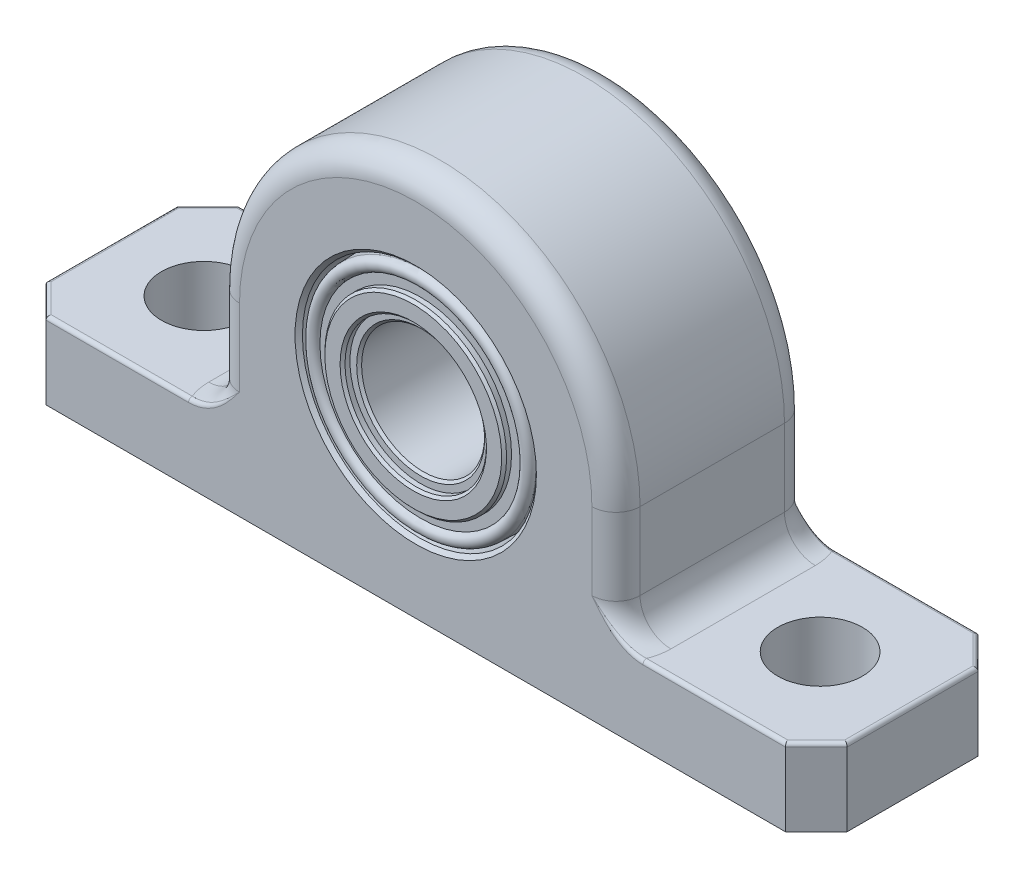
from build123d import *

# Parameters (mm, degrees)
BOSS_EXTRUDE1_DEPTH      = 9.921875
BOSS_EXTRUDE1_DEPTH_BACK = 9.921875
SKETCH3_R                = 12.05738
SKETCH4_R                = 4.365625
CUT_EXTRUDE1_DEPTH       = 59.113396775
CHAMFER1_SIZE            = 3.175
FILLET1_R                = 2.48046875
FILLET2_R                = 3.175
CHAMFER2_SIZE            = 0.381
FILLET3_R                = 0.381
CHAMFER3_SIZE            = 0.254


with BuildPart() as part:
    # Sketch3 → Boss-Extrude1 (new, two sides: drawn at the far end of the back side and taken through both)
    with BuildSketch(Plane.XY.offset(-BOSS_EXTRUDE1_DEPTH_BACK)):
        with BuildLine():
            Line((-41.275, 0), (-41.275, 7.9375))
            Line((-41.275, 7.9375), (-20.6375, 7.9375))
            Line((-20.6375, 7.9375), (-20.6375, 19.05))
            ThreePointArc((-20.6375, 19.05), (0, 39.6875), (20.6375, 19.05))
            Line((20.6375, 19.05), (20.6375, 7.9375))
            Line((20.6375, 7.9375), (41.275, 7.9375))
            Line((41.275, 7.9375), (41.275, 0))
            Line((41.275, 0), (-41.275, 0))
        make_face()
        with Locations((0, 19.05)):
            Circle(SKETCH3_R, mode=Mode.SUBTRACT)
    extrude(amount=BOSS_EXTRUDE1_DEPTH + BOSS_EXTRUDE1_DEPTH_BACK)

    # Sketch4 → Cut-Extrude1 (cut, through all)
    with BuildSketch(Plane(origin=(0, 0, 0), x_dir=(1, 0, 0), z_dir=(0, 1, 0))):
        with Locations(Location((-31.75, 0, 0), (0, 0, 90))):
            Circle(SKETCH4_R)
        with Locations(Location((31.75, 0, 0), (0, 0, 90))):
            Circle(SKETCH4_R)
    extrude(amount=CUT_EXTRUDE1_DEPTH, mode=Mode.SUBTRACT)

    # Chamfer1
    chamfer1_edges = [part.edges().sort_by_distance(p)[0] for p in [
        (41.275, 3.96875, 9.921875),
        (-41.275, 3.96875, -9.921875),
        (-41.275, 3.96875, 9.921875),
        (41.275, 3.96875, -9.921875),
    ]]
    chamfer(chamfer1_edges, length=CHAMFER1_SIZE)

    # Fillet1
    fillet1_edges = [part.edges().sort_by_distance(p)[0] for p in [
        (20.6375, 13.49375, -9.921875),
        (0, 39.6875, -9.921875),
        (-20.6375, 13.49375, -9.921875),
        (20.6375, 13.49375, 9.921875),
        (0, 39.6875, 9.921875),
        (-20.6375, 13.49375, 9.921875),
    ]]
    fillet(fillet1_edges, radius=FILLET1_R)

    # Fillet2
    # the kernel refuses this fillet: 3.175 mm, written as the material it adds along each edge
    with BuildSketch(Plane(origin=(-20.6375, 7.9375, 7.44140625), x_dir=(-1, 0, 0), z_dir=(0, 0, -1))) as fillet2_piece_1:
        with BuildLine():
            CenterArc((FILLET2_R, FILLET2_R), FILLET2_R, 180, 90)
            Line((0, FILLET2_R), (0, 0))
            Line((0, 0), (FILLET2_R, 0))
        make_face()
    extrude(amount=14.8828125)
    with BuildSketch(Plane(origin=(20.6375, 7.9375, 7.44140625), x_dir=(1, 0, 0), z_dir=(0, 0, -1))) as fillet2_piece_2:
        with BuildLine():
            CenterArc((FILLET2_R, -FILLET2_R), FILLET2_R, 90, 90)
            Line((0, -FILLET2_R), (0, 0))
            Line((0, 0), (FILLET2_R, 0))
        make_face()
    extrude(amount=14.8828125)
    with BuildSketch(Plane(origin=(-18.15703125, 7.9375, -7.44140625), x_dir=(-0.059657368932763404, 0, 0.9982189130306137), z_dir=(-0.9982189130306137, 0, -0.059657368932763404))) as fillet2_piece_3_section:
        with BuildLine():
            CenterArc((-2.48046875 - FILLET2_R, FILLET2_R), FILLET2_R, 270, 90)
            Line((-2.48046875, FILLET2_R), (-2.48046875, 0))
            Line((-2.48046875, 0), (-2.48046875 - FILLET2_R, 0))
        make_face()
    fillet2_piece_3 = revolve(axis=Axis((-18.15703125, 7.9375, -7.44140625), (0, 1, 0)), revolution_arc=273.420146224, mode=Mode.PRIVATE)
    fillet2_piece_3 = split(fillet2_piece_3, bisect_by=Plane(origin=(-20.028102213, 8.977488028, -9.921875), z_dir=(0, 0, 1)), keep=Keep.TOP, mode=Mode.PRIVATE)
    add(fillet2_piece_3)
    with BuildSketch(Plane(origin=(-18.15703125, 7.9375, 7.44140625), x_dir=(-0.059657368932763404, 0, -0.9982189130306137), z_dir=(-0.9982189130306137, 0, 0.059657368932763404))) as fillet2_piece_4_section:
        with BuildLine():
            CenterArc((-2.48046875 - FILLET2_R, -FILLET2_R), FILLET2_R, 0, 90)
            Line((-2.48046875, -FILLET2_R), (-2.48046875, 0))
            Line((-2.48046875, 0), (-2.48046875 - FILLET2_R, 0))
        make_face()
    fillet2_piece_4 = revolve(axis=Axis((-18.15703125, 7.9375, 7.44140625), (0, -1, 0)), revolution_arc=273.420146224, mode=Mode.PRIVATE)
    fillet2_piece_4 = split(fillet2_piece_4, bisect_by=Plane(origin=(-20.028102213, 8.977488028, 9.921875), z_dir=(0, 0, -1)), keep=Keep.TOP, mode=Mode.PRIVATE)
    add(fillet2_piece_4)
    with BuildSketch(Plane(origin=(18.15703125, 7.9375, -7.44140625), x_dir=(0.05965736893276484, 0, 0.9982189130306137), z_dir=(0.9982189130306137, 0, -0.05965736893276484))) as fillet2_piece_5_section:
        with BuildLine():
            CenterArc((-2.48046875 - FILLET2_R, -FILLET2_R), FILLET2_R, 0, 90)
            Line((-2.48046875, -FILLET2_R), (-2.48046875, 0))
            Line((-2.48046875, 0), (-2.48046875 - FILLET2_R, 0))
        make_face()
    fillet2_piece_5 = revolve(axis=Axis((18.15703125, 7.9375, -7.44140625), (0, -1, 0)), revolution_arc=273.420146224, mode=Mode.PRIVATE)
    fillet2_piece_5 = split(fillet2_piece_5, bisect_by=Plane(origin=(20.028102127, 8.977488302, -9.921875), z_dir=(0, 0, 1)), keep=Keep.TOP, mode=Mode.PRIVATE)
    add(fillet2_piece_5)
    with BuildSketch(Plane(origin=(18.15703125, 7.9375, 7.44140625), x_dir=(0.05965736893276484, 0, -0.9982189130306137), z_dir=(0.9982189130306137, 0, 0.05965736893276484))) as fillet2_piece_6_section:
        with BuildLine():
            CenterArc((-2.48046875 - FILLET2_R, FILLET2_R), FILLET2_R, 270, 90)
            Line((-2.48046875, FILLET2_R), (-2.48046875, 0))
            Line((-2.48046875, 0), (-2.48046875 - FILLET2_R, 0))
        make_face()
    fillet2_piece_6 = revolve(axis=Axis((18.15703125, 7.9375, 7.44140625), (0, 1, 0)), revolution_arc=273.420146224, mode=Mode.PRIVATE)
    fillet2_piece_6 = split(fillet2_piece_6, bisect_by=Plane(origin=(20.028102127, 8.977488302, 9.921875), z_dir=(0, 0, -1)), keep=Keep.TOP, mode=Mode.PRIVATE)
    add(fillet2_piece_6)

    # Chamfer2
    chamfer2_edges = [part.edges().sort_by_distance(p)[0] for p in [
        (-12.05738, 19.05, -9.921875),
        (-12.05738, 19.05, 9.921875),
    ]]
    chamfer(chamfer2_edges, length=CHAMFER2_SIZE)

    # Fillet3
    fillet3_edges = [part.edges().sort_by_distance(p)[0] for p in [
        (-30.669755557, 7.9375, -9.921875),
        (-30.669755557, 7.9375, 9.921875),
        (-20.369956081, 8.957174187, -9.921875),
        (-20.369956063, 8.957174199, 9.921875),
        (20.369956063, 8.957174199, -9.921875),
        (20.369956084, 8.957174184, 9.921875),
        (-41.275, 7.9375, 0),
        (30.669755557, 7.9375, -9.921875),
        (-39.6875, 7.9375, 8.334375),
        (-39.6875, 7.9375, -8.334375),
        (30.669755557, 7.9375, 9.921875),
        (41.275, 7.9375, 0),
        (39.6875, 7.9375, -8.334375),
        (39.6875, 7.9375, 8.334375),
    ]]
    fillet(fillet3_edges, radius=FILLET3_R)


with BuildPart() as body_2:
    # Sketch6 → Revolve1 (revolve)
    with BuildSketch(Plane(origin=(0, 0, 0), x_dir=(0, 0, -1), z_dir=(1, 0, 0)), mode=Mode.PRIVATE) as revolve1_sk:
        with BuildLine():
            Line((0, 31.10738), (9.921875, 31.10738))
            Line((9.921875, 31.10738), (9.921875, 29.43207627))
            Line((9.921875, 29.43207627), (6.111875, 29.43207627))
            Line((6.111875, 29.43207627), (6.111875, 28.417924091))
            Line((6.111875, 28.417924091), (8.651875, 28.417924091))
            Line((8.651875, 28.417924091), (8.651875, 26.337895))
            Line((8.651875, 26.337895), (7.889875, 26.337895))
            Line((7.889875, 26.337895), (7.889875, 25.3873))
            Line((7.889875, 25.3873), (-9.413875, 25.3873))
            Line((-9.413875, 25.3873), (-9.413875, 26.337895))
            Line((-9.413875, 26.337895), (-10.175875, 26.337895))
            Line((-10.175875, 26.337895), (-10.175875, 28.417924091))
            Line((-10.175875, 28.417924091), (-9.413875, 28.417924091))
            Line((-9.413875, 28.417924091), (-9.413875, 29.43207627))
            ThreePointArc((-9.413875, 29.43207627), (-9.917326931, 30.175277339), (-9.257666022, 30.784095179))
            Line((-9.257666022, 30.784095179), (0, 31.10738))
        make_face()
    revolve(revolve1_sk.sketch.rotate(Axis((0, 19.05, 9.921875), (0, 0, -1)), 90), axis=Axis((0, 19.05, 9.921875), (0, 0, -1)))

    # Chamfer3
    chamfer3_edges = [body_2.edges().sort_by_distance(p)[0] for p in [
        (-9.367924091, 19.05, -8.651875),
        (-7.287895, 19.05, -8.651875),
        (-6.3373, 19.05, -7.889875),
        (-6.3373, 19.05, 9.413875),
        (-7.287895, 19.05, 10.175875),
        (-9.367924091, 19.05, 10.175875),
    ]]
    chamfer(chamfer3_edges, length=CHAMFER3_SIZE)


solid = Compound([part.part, body_2.part])
